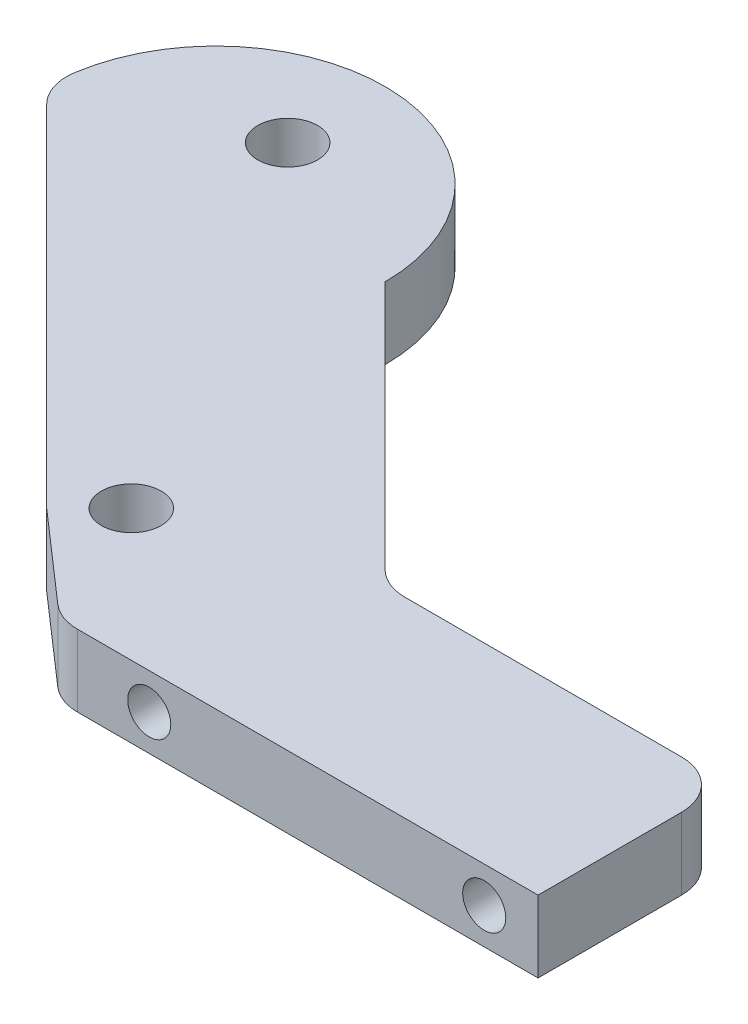
from build123d import *

# Parameters (mm, degrees)
SKETCH1_R           = 3.175
BOSS_EXTRUDE1_DEPTH = 3.81
SKETCH2_R           = 2.286
CUT_EXTRUDE1_DEPTH  = 5.08
FILLET1_R           = 5.08
SKETCH3_R           = 3.175
CUT_EXTRUDE2_DEPTH  = 78.809401293


with BuildPart() as part:
    # Sketch1 → Boss-Extrude1 (new, symmetric)
    with BuildSketch(Plane(origin=(0, 0, 0), x_dir=(1, 0, 0), z_dir=(0, 1, 0))):
        with BuildLine():
            Line((-43.270256121, 34.29), (-4.490128061, -4.490128061))
            Line((-4.490128061, -4.490128061), (6.35, -13.97))
            Line((6.35, -13.97), (57.15, -13.97))
            Line((57.15, -13.97), (57.15, 6.35))
            Line((57.15, 6.35), (20.590768363, 6.35))
            Line((20.590768363, 6.35), (-7.349231637, 34.29))
            ThreePointArc((-7.349231637, 34.29), (-25.309743879, 52.250512242), (-43.270256121, 34.29))
        make_face()
        Circle(SKETCH1_R, mode=Mode.SUBTRACT)
    extrude(amount=BOSS_EXTRUDE1_DEPTH, both=True)

    # Sketch2 → Cut-Extrude1 (cut)
    with BuildSketch(Plane.XY.offset(13.97)):
        with Locations((51.437940654, 0)):
            Circle(SKETCH2_R)
        with Locations((15.877940654, 0)):
            Circle(SKETCH2_R)
    extrude(amount=-CUT_EXTRUDE1_DEPTH, mode=Mode.SUBTRACT)

    # Fillet1
    fillet1_edges = [part.edges().sort_by_distance(p)[0] for p in [
        (57.15, 0, -6.35),
        (20.590768363, 0, -6.35),
        (6.35, 0, 13.97),
        (-43.270256121, 0, -34.29),
    ]]
    fillet(fillet1_edges, radius=FILLET1_R)

    # Sketch3 → Cut-Extrude2 (cut, through all)
    with BuildSketch(Plane(origin=(0, 3.81, 0), x_dir=(1, 0, 0), z_dir=(0, 1, 0))):
        with Locations((-25.309743879, 41.91)):
            Circle(SKETCH3_R)
    extrude(amount=-CUT_EXTRUDE2_DEPTH, mode=Mode.SUBTRACT)


solid = part.part
